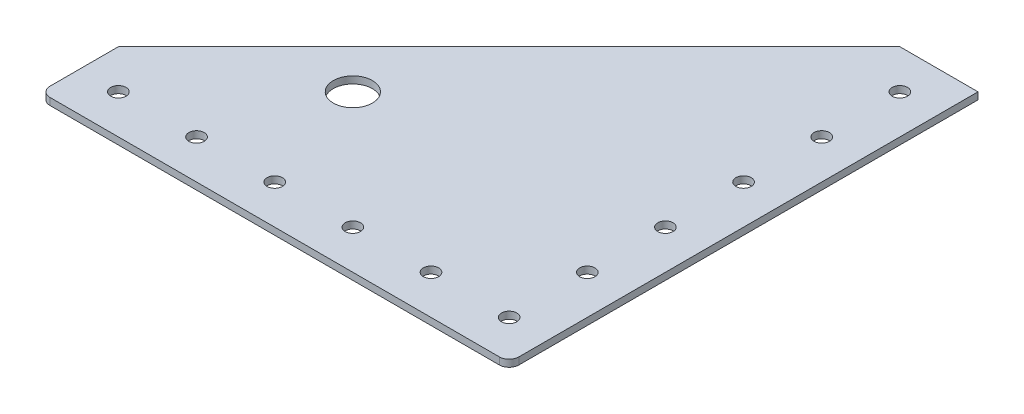
from build123d import *

# Parameters (mm, degrees)
SKETCH1_R           = 2.4892
SKETCH1_R_2         = 6.35
BOSS_EXTRUDE2_DEPTH = 1.143
FILLET1_R           = 3.175


with BuildPart() as part:
    # Sketch1 → Boss-Extrude2 (new, symmetric)
    with BuildSketch(Plane(origin=(0, 0, 0), x_dir=(1, 0, 0), z_dir=(0, 1, 0))):
        Polygon((0, 0), (0, 152.4), (-25.4, 152.4), (-152.4, 25.4), (-152.4, 0), align=None)
        with Locations((-12.7, 12.7)):
            Circle(SKETCH1_R, mode=Mode.SUBTRACT)
        with Locations((-38.1, 12.7)):
            Circle(SKETCH1_R, mode=Mode.SUBTRACT)
        with Locations((-63.5, 12.7)):
            Circle(SKETCH1_R, mode=Mode.SUBTRACT)
        with Locations((-88.9, 12.7)):
            Circle(SKETCH1_R, mode=Mode.SUBTRACT)
        with Locations((-114.3, 12.7)):
            Circle(SKETCH1_R, mode=Mode.SUBTRACT)
        with Locations((-12.7, 38.1)):
            Circle(SKETCH1_R, mode=Mode.SUBTRACT)
        with Locations((-12.7, 63.5)):
            Circle(SKETCH1_R, mode=Mode.SUBTRACT)
        with Locations((-12.7, 88.9)):
            Circle(SKETCH1_R, mode=Mode.SUBTRACT)
        with Locations((-12.7, 114.3)):
            Circle(SKETCH1_R, mode=Mode.SUBTRACT)
        with Locations((-139.7, 12.7)):
            Circle(SKETCH1_R, mode=Mode.SUBTRACT)
        with Locations((-12.7, 139.7)):
            Circle(SKETCH1_R, mode=Mode.SUBTRACT)
        with Locations((-101.6, 50.8)):
            Circle(SKETCH1_R_2, mode=Mode.SUBTRACT)
    extrude(amount=BOSS_EXTRUDE2_DEPTH, both=True)

    # Fillet1
    fillet1_edges = [part.edges().sort_by_distance(p)[0] for p in [
        (0, 0, 0),
        (-152.4, 0, 0),
    ]]
    fillet(fillet1_edges, radius=FILLET1_R)


solid = part.part
